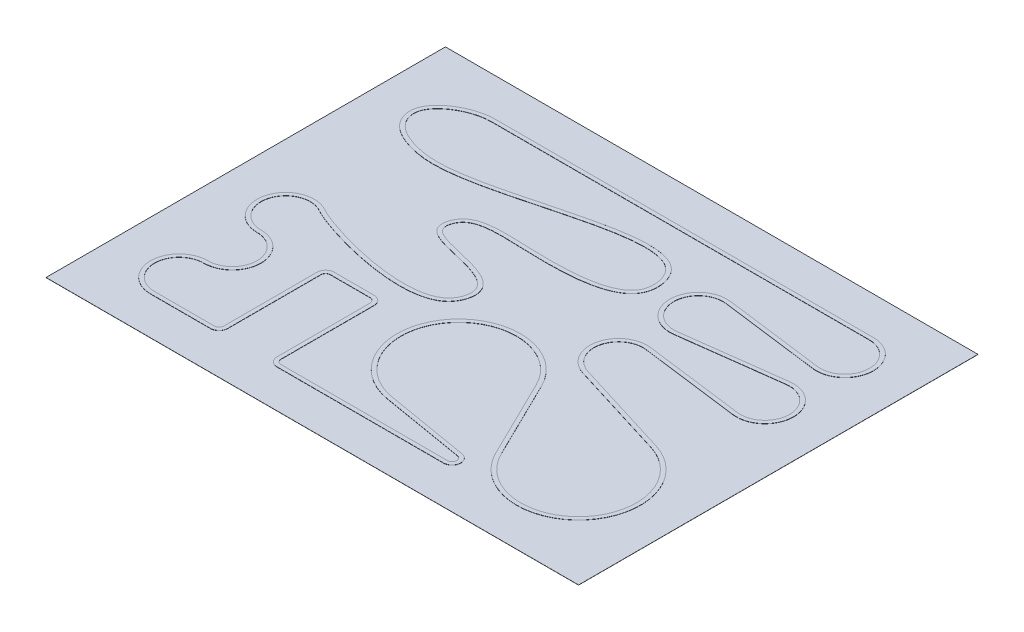
from build123d import *

# Parameters (mm, degrees)
SKETCH_1_W      = 4000
SKETCH_1_H      = 3000
EXTRUDE_1_DEPTH = 1
SWEEP_START     = 1
SWEEP_2_DEPTH   = 1.5


# Read off the part's stored shape, not the designer's step: 扫描2
with BuildPart() as part:
    # 草图1 → 凸台-拉伸1 (new body)
    with BuildSketch(Plane(origin=(0, 0, 0), x_dir=(1, 0, 0), z_dir=(0, 1, 0))):
        Rectangle(SKETCH_1_W, SKETCH_1_H)
    extrude(amount=EXTRUDE_1_DEPTH)


with BuildPart() as body_2:
    # 扫描2 outline → 扫描2 (new body)
    with BuildSketch(Plane(origin=(0, 0, 0), x_dir=(1, 0, 0), z_dir=(0, 1, 0)).offset(SWEEP_START)):
        with BuildLine():
            Line((1500, 1215), (-1336.581471275, 1215))
            add(Edge.make_bspline(
                [(-1336.581471275, 1215), (-1367.970059836, 1215), (-1430.809295926, 1207.431470674), (-1519.101158857, 1177.872170676), (-1597.075842966, 1134.305354769), (-1649.455874015, 1089.596122594), (-1681.390389745, 1050.46363669), (-1699.428173198, 1020.224946502), (-1707.430707907, 999.026479879), (-1712.920864292, 977.795118467), (-1715.867621804, 956.125205567), (-1714.547779471, 932.661003043), (-1711.515054587, 913.324689598), (-1706.102078092, 890.003382945), (-1692.902056294, 857.846662342), (-1668.385842711, 822.761907591), (-1636.108100916, 791.903189309), (-1596.58796583, 765.051110152), (-1555.720074939, 744.65019732), (-1521.125459551, 731.035086448), (-1465.833566272, 712.179807277), (-1397.72139348, 696.462253343), (-1299.956829873, 689.192809217), (-1193.313171912, 692.051636945), (-865.092642665, 737.431154111), (-436.160686766, 873.467025874), (-79.374236495, 939.26333875), (45.399117905, 948.126735158), (126.062304001, 942.573002497), (174.354170741, 933.846480371), (216.647087036, 919.779385277), (252.556380215, 900.136485079), (278.338399186, 877.741694985), (293.955957721, 857.811007675), (307.191279039, 836.329826964), (319.689619205, 808.189322393), (329.309529717, 768.425644489), (331.924125726, 727.794290882), (327.928122459, 695.409767672), (321.026027065, 671.747193676), (311.548845329, 649.788245757), (295.054469289, 625.040018249), (261.937040453, 593.201031432), (209.374840047, 562.344926307), (132.543558582, 536.169272506), (43.586337018, 518.537802664), (-113.08585245, 501.778564), (-258.916433722, 502.706125056), (-473.888512331, 509.397824094), (-602.059865015, 516.427455955), (-709.779697462, 498.587644556), (-751.23336034, 486.239658095), (-787.623493434, 468.080171722), (-818.232508608, 442.985877591), (-836.436006501, 417.871438654), (-847.845401927, 394.939170319), (-856.461967422, 372.189870622), (-861.44531065, 345.599721609), (-860.219884562, 320.111107976), (-856.116492501, 303.128207896), (-850.519895184, 291.003185482), (-843.464965473, 279.574691957), (-830.300235672, 264.11732321), (-804.96426967, 245.775662621), (-768.725381586, 228.616900883), (-726.755057489, 214.124942733), (-647.233288908, 192.192766193), (-543.063443201, 170.400998732), (-434.565559109, 137.937857878), (-374.755176374, 109.639784742), (-338.871213461, 81.847611154), (-318.799932636, 58.338983717), (-307.33773318, 34.590868965), (-303.017190729, 14.463447084), (-301.589592561, -6.299308233), (-303.592603929, -31.451462473), (-313.194727267, -64.746153262), (-329.842606187, -96.982455859), (-346.881739705, -117.87609328), (-365.30180268, -135.100870115), (-386.111571788, -150.504039603), (-433.03968649, -173.733649396), (-508.322490828, -192.571475921), (-615.064920574, -199.420256125), (-786.874763168, -190.211272745), (-990.118524096, -151.84055143), (-1186.823863915, -96.398722412), (-1317.886457435, -50.144269936), (-1374.337996261, -24.250219605), (-1392.806612623, -13.627851591)],
                knots=[0, 0, 0, 0, 0.015625, 0.03125, 0.046875, 0.0625, 0.0703125, 0.078125, 0.085627607, 0.0859375, 0.09375, 0.1015625, 0.104066228, 0.109375, 0.12109375, 0.1328125, 0.14453125, 0.15625, 0.16796875, 0.175461771, 0.1796875, 0.203125, 0.213165301, 0.2265625, 0.25, 0.34375, 0.3671875, 0.390625, 0.4, 0.409375, 0.41875, 0.428125, 0.4375, 0.443397993, 0.446289062, 0.455078125, 0.463867188, 0.47265625, 0.481445312, 0.48583335, 0.490234375, 0.499023438, 0.5078125, 0.522578125, 0.53734375, 0.552109375, 0.566875, 0.608739791, 0.61328125, 0.666015625, 0.6765625, 0.687109375, 0.69765625, 0.708203125, 0.71875, 0.721965131, 0.727539062, 0.736328125, 0.740722656, 0.745117188, 0.748182064, 0.749511719, 0.75390625, 0.761289062, 0.768671875, 0.776054687, 0.7834375, 0.806640625, 0.819824219, 0.833007812, 0.839599609, 0.846191406, 0.852783203, 0.85727278, 0.859375, 0.865234375, 0.87109375, 0.876953125, 0.8828125, 0.883818208, 0.888671875, 0.89453125, 0.90555625, 0.91658125, 0.92760625, 0.95359375, 0.9690625, 0.98453125, 1, 1, 1, 1], degree=3))
            ThreePointArc((-1392.806612623, -13.627851591), (-1707.719777474, -144.52483397), (-1500, -415))
            ThreePointArc((-1500, -415), (-1315, -600), (-1500, -785))
            ThreePointArc((-1500, -785), (-1715, -1000), (-1500, -1215))
            Line((-1500, -1215), (-1050, -1215))
            ThreePointArc((-1050, -1215), (-1004.038059223, -1195.961940777), (-985, -1150))
            Line((-985, -1150), (-985, -450))
            ThreePointArc((-985, -450), (-974.748737342, -425.251262658), (-950, -415))
            Line((-950, -415), (-650, -415))
            ThreePointArc((-650, -415), (-625.251262658, -425.251262658), (-615, -450))
            Line((-615, -450), (-615, -1150))
            ThreePointArc((-615, -1150), (-595.961940777, -1195.961940777), (-550, -1215))
            Line((-550, -1215), (700, -1215))
            ThreePointArc((700, -1215), (764.772565589, -1155.432747647), (710.827477024, -1085.908146061))
            Line((710.827477024, -1085.908146061), (77.539192224, -978.922407128))
            ThreePointArc((77.539192224, -978.922407128), (-198.539877739, -289.721392301), (540.687417082, -358.71920605))
            Line((540.687417082, -358.71920605), (832.36862312, -954.472572843))
            ThreePointArc((832.36862312, -954.472572843), (1603.416279424, -1052.195190958), (1387.130734083, -305.680113241))
            Line((1387.130734083, -305.680113241), (645.442611171, -76.772428066))
            ThreePointArc((645.442611171, -76.772428066), (519.216016109, 139.270232599), (723.696464225, 283.4760954))
            Line((723.696464225, 283.4760954), (1472.460865901, 186.771024265))
            ThreePointArc((1472.460865901, 186.771024265), (1715, 400), (1472.460865901, 613.228975735))
            Line((1472.460865901, 613.228975735), (723.696464225, 516.5239046))
            ThreePointArc((723.696464225, 516.5239046), (515, 700), (723.696464225, 883.4760954))
            Line((723.696464225, 883.4760954), (1472.460865901, 786.771024265))
            ThreePointArc((1472.460865901, 786.771024265), (1714.556787102, 986.201988967), (1500, 1215))
        make_face()
        with BuildLine():
            add(Edge.make_bspline(
                [(-1336.581471275, 1185), (-1365.763237477, 1185), (-1423.966875115, 1177.995170915), (-1506.961611537, 1150.263865742), (-1580.027044973, 1109.399016602), (-1628.330949958, 1068.038901073), (-1656.847996875, 1033.034886555), (-1672.404429019, 1006.823272107), (-1678.903401836, 989.512695866), (-1683.33546031, 972.377331898), (-1685.691101537, 955.088344275), (-1684.640326884, 935.584791171), (-1682.064871361, 919.219300123), (-1677.462074893, 899.344146711), (-1666.391660206, 872.434441266), (-1645.601290875, 842.580275519), (-1617.365127226, 815.504007826), (-1581.580922777, 791.130556536), (-1543.550076674, 772.107077275), (-1510.732566536, 759.193142548), (-1458.061223088, 741.2209565), (-1393.067684894, 726.230157685), (-1299.366544084, 719.210875361), (-1196.378125027, 721.987602969), (-873.40720529, 766.414893231), (-444.816281869, 902.316605377), (-83.646391114, 969.004698875), (44.598959229, 978.235398446), (129.551367658, 972.429120106), (181.523838984, 963.077963964), (228.402547628, 947.556070536), (269.625511417, 925.091699306), (300.059524901, 898.731640672), (318.540182346, 875.088021981), (334.046815297, 849.957433313), (348.277048926, 817.771644567), (359.113229837, 772.977785814), (362.07386389, 727.079166643), (357.562015105, 689.795936761), (349.312688348, 661.596091035), (337.922709861, 635.09759979), (318.083947741, 605.439437829), (279.545489267, 568.535068068), (221.342803835, 534.6344362), (139.970820655, 507.021248169), (47.888527643, 488.811907053), (-112.229413971, 471.704278444), (-259.492202288, 472.76705851), (-475.249899943, 479.37436831), (-602.706440546, 486.009418298), (-703.306939661, 469.213381945), (-740.484704576, 458.07299883), (-771.420333259, 442.528171662), (-796.174462138, 422.130699147), (-810.81002666, 402.031260289), (-820.228332647, 383.046389515), (-827.426414394, 364.122177488), (-831.276280176, 342.814515767), (-830.331830302, 324.255067149), (-827.481534042, 312.761885977), (-823.968062757, 305.08187995), (-819.378209656, 297.696292256), (-810.380491766, 286.962057311), (-790.153578989, 272.037033618), (-757.715709945, 256.580641089), (-718.07373155, 242.860653532), (-640.78009683, 221.514931974), (-536.376789442, 199.679200908), (-424.456893765, 166.26665333), (-359.902483875, 136.013408866), (-318.355275542, 104.023464236), (-293.570237739, 75.202353832), (-278.710853147, 44.57313574), (-273.253429387, 18.791942215), (-271.45290603, -7.025528911), (-273.928637735, -37.043922398), (-285.162404332, -75.950234527), (-304.53727064, -113.491979712), (-324.601945943, -138.130046289), (-346.321174786, -158.411748906), (-370.74717172, -176.482088196), (-423.485043354, -202.42788805), (-504.303598016, -222.446684427), (-615.21949721, -229.482349836), (-791.162068932, -220.003045431), (-996.846655603, -181.11975553), (-1195.89607756, -124.995487744), (-1328.310152118, -78.352792419), (-1388.028437059, -50.984231734), (-1407.763829466, -39.633267648)],
                knots=[0, 0, 0, 0, 0.015625, 0.03125, 0.046875, 0.0625, 0.0703125, 0.078125, 0.085627607, 0.0859375, 0.09375, 0.1015625, 0.104066228, 0.109375, 0.12109375, 0.1328125, 0.14453125, 0.15625, 0.16796875, 0.175461771, 0.1796875, 0.203125, 0.213165301, 0.2265625, 0.25, 0.34375, 0.3671875, 0.390625, 0.4, 0.409375, 0.41875, 0.428125, 0.4375, 0.443397993, 0.446289062, 0.455078125, 0.463867188, 0.47265625, 0.481445312, 0.48583335, 0.490234375, 0.499023438, 0.5078125, 0.522578125, 0.53734375, 0.552109375, 0.566875, 0.608739791, 0.61328125, 0.666015625, 0.6765625, 0.687109375, 0.69765625, 0.708203125, 0.71875, 0.721965131, 0.727539062, 0.736328125, 0.740722656, 0.745117188, 0.748182064, 0.749511719, 0.75390625, 0.761289062, 0.768671875, 0.776054687, 0.7834375, 0.806640625, 0.819824219, 0.833007812, 0.839599609, 0.846191406, 0.852783203, 0.85727278, 0.859375, 0.865234375, 0.87109375, 0.876953125, 0.8828125, 0.883818208, 0.888671875, 0.89453125, 0.90555625, 0.91658125, 0.92760625, 0.95359375, 0.9690625, 0.98453125, 1, 1, 1, 1], degree=3))
            Line((-1336.581471275, 1185), (1500, 1185))
            ThreePointArc((1500, 1185), (1684.618630762, 988.127292832), (1476.303535775, 816.5239046))
            Line((1476.303535775, 816.5239046), (727.539134099, 913.228975735))
            ThreePointArc((727.539134099, 913.228975735), (485, 700), (727.539134099, 486.771024265))
            Line((727.539134099, 486.771024265), (1476.303535775, 583.4760954))
            ThreePointArc((1476.303535775, 583.4760954), (1685, 400), (1476.303535775, 216.5239046))
            Line((1476.303535775, 216.5239046), (727.539134099, 313.228975735))
            ThreePointArc((727.539134099, 313.228975735), (489.899694397, 145.638378426), (636.595467037, -105.438227211))
            Line((636.595467037, -105.438227211), (1378.283589948, -334.345912386))
            ThreePointArc((1378.283589948, -334.345912386), (1580.615229138, -1032.698727025), (859.312582918, -941.28079395))
            Line((859.312582918, -941.28079395), (567.63137688, -345.527427157))
            ThreePointArc((567.63137688, -345.527427157), (-222.577110687, -271.771143495), (72.541895136, -1008.503262792))
            Line((72.541895136, -1008.503262792), (705.830179936, -1115.489001725))
            ThreePointArc((705.830179936, -1115.489001725), (734.877535317, -1152.925325656), (700, -1185))
            Line((700, -1185), (-550, -1185))
            ThreePointArc((-550, -1185), (-574.748737342, -1174.748737342), (-585, -1150))
            Line((-585, -1150), (-585, -450))
            ThreePointArc((-585, -450), (-604.038059223, -404.038059223), (-650, -385))
            Line((-650, -385), (-950, -385))
            ThreePointArc((-950, -385), (-995.961940777, -404.038059223), (-1015, -450))
            Line((-1015, -450), (-1015, -1150))
            ThreePointArc((-1015, -1150), (-1025.251262658, -1174.748737342), (-1050, -1185))
            Line((-1050, -1185), (-1500, -1185))
            ThreePointArc((-1500, -1185), (-1685, -1000), (-1500, -815))
            ThreePointArc((-1500, -815), (-1285, -600), (-1500, -385))
            ThreePointArc((-1500, -385), (-1678.735622478, -152.265554811), (-1407.763829466, -39.633267648))
        make_face(mode=Mode.SUBTRACT)
    extrude(amount=SWEEP_2_DEPTH)


solid = Compound([part.part, body_2.part])
